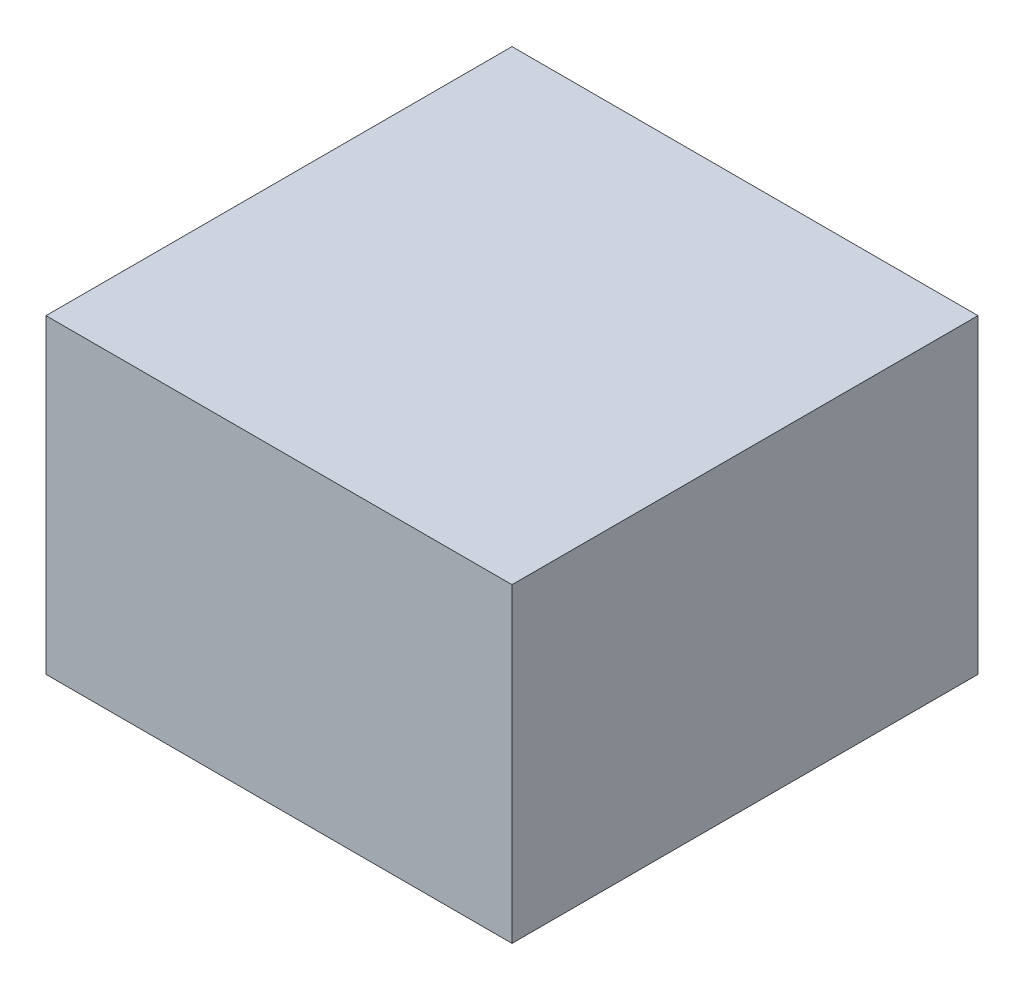
from build123d import *

# Parameters (mm, degrees)
SKETCH1_W           = 75
SKETCH1_H           = 75
BOSS_EXTRUDE1_DEPTH = 50


with BuildPart() as part:
    # Sketch1 → Boss-Extrude1 (new body)
    with BuildSketch(Plane(origin=(0, 0, 0), x_dir=(1, 0, 0), z_dir=(0, 1, 0))):
        with Locations((0, 37.5)):
            Rectangle(SKETCH1_W, SKETCH1_H)
    extrude(amount=BOSS_EXTRUDE1_DEPTH)


solid = part.part
